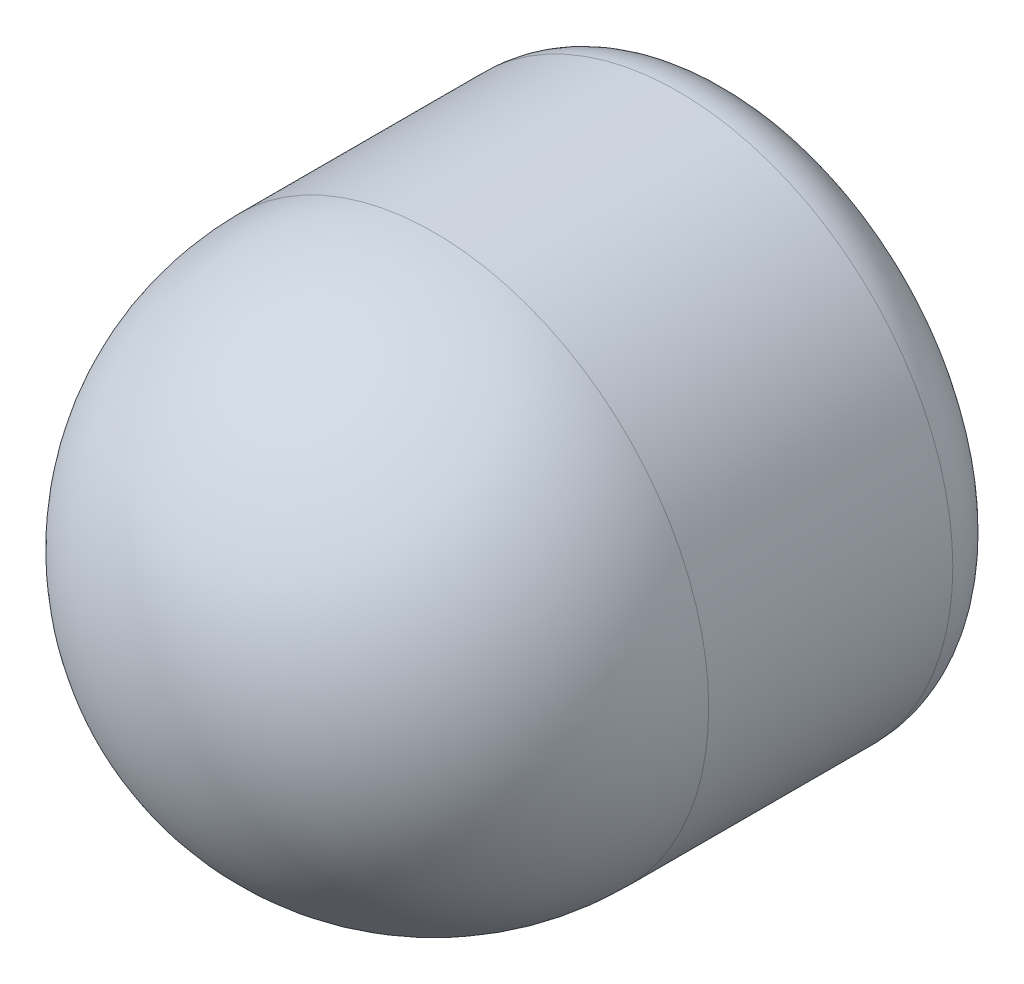
from build123d import *

# Parameters (mm, degrees)
SKETCH_3_R          = 9
EXTRUDE_1_DEPTH     = 10
SKETCH_2_W          = 10.5
SKETCH_2_H          = 10.5
CUT_EXTRUDE_1_DEPTH = 10
FILLET_1_R          = 2


with BuildPart() as part:
    # 草图1 → 旋转1 (revolve)
    with BuildSketch(Plane.XY):
        with BuildLine():
            Line((0, 9), (0, -9))
            ThreePointArc((0, -9), (9, 0), (0, 9))
        make_face()
    revolve(axis=Axis((0, 9, 0), (0, -1, 0)))

    # 草图3 → 凸台-拉伸1 (add)
    with BuildSketch(Plane.XY):
        Circle(SKETCH_3_R)
    extrude(amount=-EXTRUDE_1_DEPTH)

    # 草图2 → 切除-拉伸1 (cut)
    with BuildSketch(Plane.XY):
        Rectangle(SKETCH_2_W, SKETCH_2_H)
    extrude(amount=-CUT_EXTRUDE_1_DEPTH, mode=Mode.SUBTRACT)

    # 圆角1
    # the kernel refuses this fillet: 2 mm, written as the material it takes off along each edge
    with BuildSketch(Plane(origin=(0, 0, -10), x_dir=(1, 0, 0), z_dir=(0, -1, 0))) as fillet_1_piece_1:
        with BuildLine():
            CenterArc((9 - FILLET_1_R, FILLET_1_R), FILLET_1_R, 270, 90)
            Line((9 - FILLET_1_R, 0), (9, 0))
            Line((9, 0), (9, FILLET_1_R))
        make_face()
    revolve(axis=Axis((0, 0, -10), (0, 0, 1)), mode=Mode.SUBTRACT)


solid = part.part
